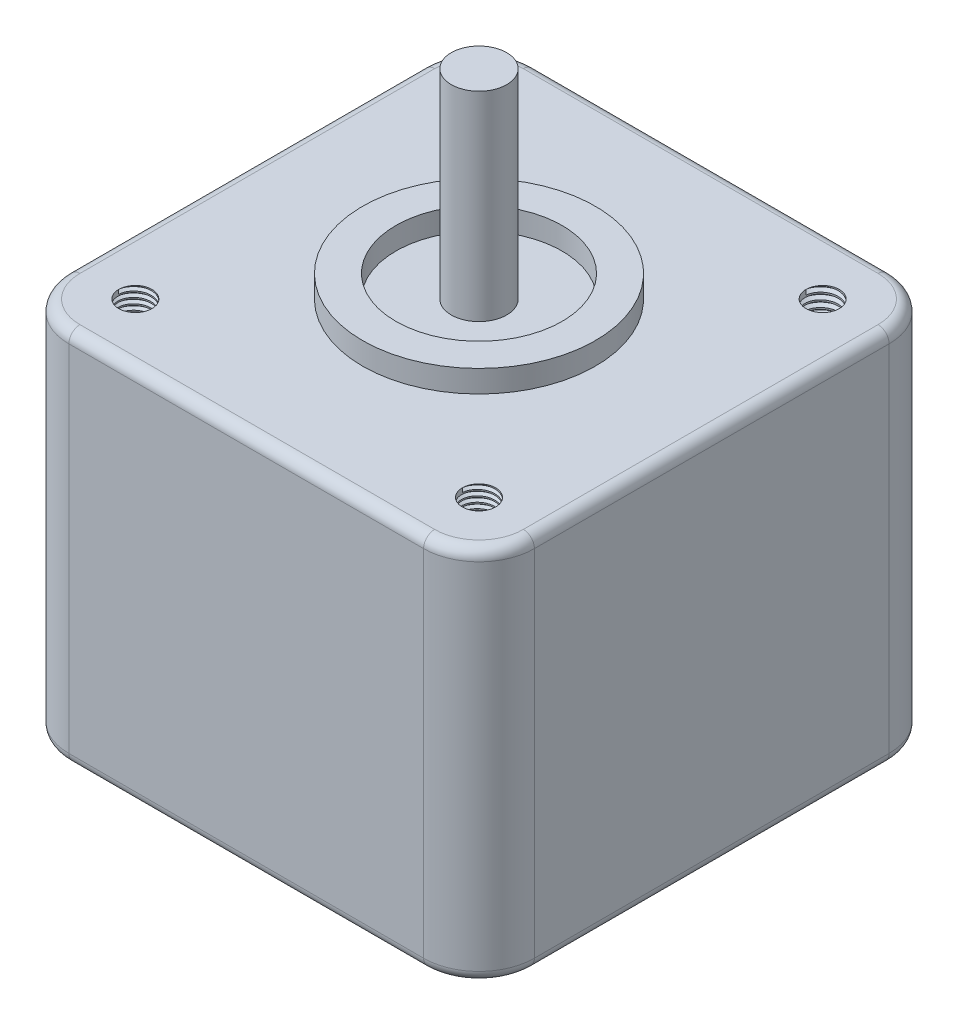
from build123d import *

# Parameters (mm, degrees)
BOSS_EXTRUDE1_DEPTH     = 34
SKETCH3_R               = 10.5
SKETCH3_R_2             = 7.5
BOSS_EXTRUDE2_DEPTH     = 2
SKETCH4_R               = 2.5
BOSS_EXTRUDE3_DEPTH     = 18
ADVANCEDHOLE1_START     = 29
ADVANCEDHOLE1_OUTLINE_R = 1.5
ADVANCEDHOLE1_DEPTH     = 5
THREAD1_PITCH           = 0.6
LPATTERN1_COUNT         = 2
LPATTERN1_PITCH         = 31
THREAD2_PITCH           = 0.5
THREAD3_PITCH           = 0.5
FILLET1_R               = 1


# Read off the part's stored shape, not the designer's step: AdvancedHole1
with BuildPart() as part:
    # Sketch2 → Boss-Extrude1 (new body)
    with BuildSketch(Plane(origin=(0, 0, 0), x_dir=(1, 0, 0), z_dir=(0, 1, 0))):
        with BuildLine():
            Line((-16, -21), (16, -21))
            ThreePointArc((16, -21), (19.535533906, -19.535533906), (21, -16))
            Line((21, -16), (21, 16))
            ThreePointArc((21, 16), (19.535533906, 19.535533906), (16, 21))
            Line((16, 21), (-16, 21))
            ThreePointArc((-16, 21), (-19.535533906, 19.535533906), (-21, 16))
            Line((-21, 16), (-21, -16))
            ThreePointArc((-21, -16), (-19.535533906, -19.535533906), (-16, -21))
        make_face()
    extrude(amount=BOSS_EXTRUDE1_DEPTH)

    # Sketch3 → Boss-Extrude2 (add)
    with BuildSketch(Plane(origin=(0, 34, 0), x_dir=(1, 0, 0), z_dir=(0, 1, 0))):
        with Locations(Location((0, 0, 0), (0, 0, 270))):
            Circle(SKETCH3_R)
        with Locations(Location((0, 0, 0), (0, 0, 270))):
            Circle(SKETCH3_R_2, mode=Mode.SUBTRACT)
    extrude(amount=BOSS_EXTRUDE2_DEPTH)

    # Sketch4 → Boss-Extrude3 (add)
    with BuildSketch(Plane(origin=(0, 34, 0), x_dir=(1, 0, 0), z_dir=(0, 1, 0))):
        with Locations(Location((0, 0, 0), (0, 0, 270))):
            Circle(SKETCH4_R)
    extrude(amount=BOSS_EXTRUDE3_DEPTH)

    # AdvancedHole1 outline → AdvancedHole1 (cut)
    with BuildSketch(Plane(origin=(0, 0, 0), x_dir=(1, 0, 0), z_dir=(0, 1, 0)).offset(ADVANCEDHOLE1_START)):
        with Locations((-15.5, -15.5)):
            Circle(ADVANCEDHOLE1_OUTLINE_R)
        with Locations((15.5, -15.5)):
            Circle(ADVANCEDHOLE1_OUTLINE_R)
        with Locations((15.5, 15.5)):
            Circle(ADVANCEDHOLE1_OUTLINE_R)
        with Locations((-15.5, 15.5)):
            Circle(ADVANCEDHOLE1_OUTLINE_R)
    extrude(amount=ADVANCEDHOLE1_DEPTH, mode=Mode.SUBTRACT)

    # Thread1: the profile of Thread Profile1 profile screwed along a right-hand helix of 8.333333 turns, 6 arcs to a turn; built about Z, then put on its axis
    thread1_z = Axis((0, 0, 0), (0, 0, 1))
    thread1_corners = [(1.4997, 0, -0.000173205), (1.824759525, 0, 0.187499999), (1.824759525, 0, 0.262499999), (1.4997, 0, 0.450173203)]
    with BuildLine(mode=Mode.PRIVATE) as thread1_profile:
        Line(thread1_corners[0], thread1_corners[1])
        Line(thread1_corners[1], thread1_corners[2])
        Line(thread1_corners[2], thread1_corners[3])
        Line(thread1_corners[3], thread1_corners[0])
    thread1_cap = Face(thread1_profile.wire())
    thread1_turn_angles = [0, 30, 60, 90, 120, 150, 180, 210, 240, 270, 300, 330, 360]
    thread1_turn_weights = [1, 0.8660254037844387, 1, 0.8660254037844387, 1, 0.8660254037844387, 1, 0.8660254037844387, 1, 0.8660254037844387, 1, 0.8660254037844387, 1]
    thread1_turn_rails = [Edge.make_bspline([Vector(p[0], p[1], 0).rotate(thread1_z, thread1_turn_angles[k]) / thread1_turn_weights[k] + Vector(0, 0, p[2] + THREAD1_PITCH * thread1_turn_angles[k] / 360) for k in range(13)], [0, 0, 0, 1, 1, 2, 2, 3, 3, 4, 4, 5, 5, 6, 6, 6], 2, thread1_turn_weights) for p in thread1_corners]
    thread1_turn_sides = [Face.make_surface_from_curves(thread1_turn_rails[p[0]], thread1_turn_rails[p[1]]) for p in [(0, 1), (1, 2), (2, 3), (3, 0)]]
    thread1_last_angles = [2880, 2910, 2940, 2970, 3000]
    thread1_last_weights = [1, 0.8660254037844387, 1, 0.8660254037844367, 1]
    thread1_last_rails = [Edge.make_bspline([Vector(p[0], p[1], 0).rotate(thread1_z, thread1_last_angles[k]) / thread1_last_weights[k] + Vector(0, 0, p[2] + THREAD1_PITCH * thread1_last_angles[k] / 360) for k in range(5)], [0, 0, 0, 1, 1, 2, 2, 2], 2, thread1_last_weights) for p in thread1_corners]
    thread1_last_sides = [Face.make_surface_from_curves(thread1_last_rails[p[0]], thread1_last_rails[p[1]]) for p in [(0, 1), (1, 2), (2, 3), (3, 0)]]
    thread1 = Plane(origin=(-15.5, 34, -15.5), x_dir=(-1, 0, 0), z_dir=(0, -1, 0)) * Solid(Shell([*[p.moved(Location((0, 0, THREAD1_PITCH * i))) for i in range(8) for p in thread1_turn_sides], *thread1_last_sides, thread1_cap, thread1_cap.rotate(thread1_z, 3000).moved(Location((0, 0, THREAD1_PITCH * 3000 / 360)))]))
    add(thread1, mode=Mode.SUBTRACT)

    # LPattern1: Thread1 ×2
    with Locations(*[(i * LPATTERN1_PITCH, 0, 0) for i in range(1, LPATTERN1_COUNT)]):
        add(thread1, mode=Mode.SUBTRACT)

    # Thread2: the profile of Thread Profile4 profile screwed along a right-hand helix of 10 turns, 6 arcs to a turn; built about Z, then put on its axis
    thread2_z = Axis((0, 0, 0), (0, 0, 1))
    thread2_corners = [(1.4997, 0, -0.000173205), (1.770632938, 0, 0.156249999), (1.770632938, 0, 0.218749999), (1.4997, 0, 0.375173204)]
    with BuildLine(mode=Mode.PRIVATE) as thread2_profile:
        Line(thread2_corners[0], thread2_corners[1])
        Line(thread2_corners[1], thread2_corners[2])
        Line(thread2_corners[2], thread2_corners[3])
        Line(thread2_corners[3], thread2_corners[0])
    thread2_cap = Face(thread2_profile.wire())
    thread2_turn_angles = [0, 30, 60, 90, 120, 150, 180, 210, 240, 270, 300, 330, 360]
    thread2_turn_weights = [1, 0.8660254037844387, 1, 0.8660254037844387, 1, 0.8660254037844387, 1, 0.8660254037844387, 1, 0.8660254037844387, 1, 0.8660254037844387, 1]
    thread2_turn_rails = [Edge.make_bspline([Vector(p[0], p[1], 0).rotate(thread2_z, thread2_turn_angles[k]) / thread2_turn_weights[k] + Vector(0, 0, p[2] + THREAD2_PITCH * thread2_turn_angles[k] / 360) for k in range(13)], [0, 0, 0, 1, 1, 2, 2, 3, 3, 4, 4, 5, 5, 6, 6, 6], 2, thread2_turn_weights) for p in thread2_corners]
    thread2_turn_sides = [Face.make_surface_from_curves(thread2_turn_rails[p[0]], thread2_turn_rails[p[1]]) for p in [(0, 1), (1, 2), (2, 3), (3, 0)]]
    thread2 = Plane(origin=(15.5, 34, 15.5), x_dir=(-1, 0, 0), z_dir=(0, -1, 0)) * Solid(Shell([*[p.moved(Location((0, 0, THREAD2_PITCH * i))) for i in range(10) for p in thread2_turn_sides], thread2_cap, thread2_cap.rotate(thread2_z, 3600).moved(Location((0, 0, THREAD2_PITCH * 3600 / 360)))]))
    add(thread2, mode=Mode.SUBTRACT)

    # Thread3: the profile of Thread Profile5 profile screwed along a right-hand helix of 10 turns, 6 arcs to a turn; built about Z, then put on its axis
    thread3_z = Axis((0, 0, 0), (0, 0, 1))
    thread3_corners = [(1.4997, 0, -0.000173205), (1.770632938, 0, 0.156249999), (1.770632938, 0, 0.218749999), (1.4997, 0, 0.375173204)]
    with BuildLine(mode=Mode.PRIVATE) as thread3_profile:
        Line(thread3_corners[0], thread3_corners[1])
        Line(thread3_corners[1], thread3_corners[2])
        Line(thread3_corners[2], thread3_corners[3])
        Line(thread3_corners[3], thread3_corners[0])
    thread3_cap = Face(thread3_profile.wire())
    thread3_turn_angles = [0, 30, 60, 90, 120, 150, 180, 210, 240, 270, 300, 330, 360]
    thread3_turn_weights = [1, 0.8660254037844387, 1, 0.8660254037844387, 1, 0.8660254037844387, 1, 0.8660254037844387, 1, 0.8660254037844387, 1, 0.8660254037844387, 1]
    thread3_turn_rails = [Edge.make_bspline([Vector(p[0], p[1], 0).rotate(thread3_z, thread3_turn_angles[k]) / thread3_turn_weights[k] + Vector(0, 0, p[2] + THREAD3_PITCH * thread3_turn_angles[k] / 360) for k in range(13)], [0, 0, 0, 1, 1, 2, 2, 3, 3, 4, 4, 5, 5, 6, 6, 6], 2, thread3_turn_weights) for p in thread3_corners]
    thread3_turn_sides = [Face.make_surface_from_curves(thread3_turn_rails[p[0]], thread3_turn_rails[p[1]]) for p in [(0, 1), (1, 2), (2, 3), (3, 0)]]
    thread3 = Plane(origin=(-15.5, 34, 15.5), x_dir=(-1, 0, 0), z_dir=(0, -1, 0)) * Solid(Shell([*[p.moved(Location((0, 0, THREAD3_PITCH * i))) for i in range(10) for p in thread3_turn_sides], thread3_cap, thread3_cap.rotate(thread3_z, 3600).moved(Location((0, 0, THREAD3_PITCH * 3600 / 360)))]))
    add(thread3, mode=Mode.SUBTRACT)

    # Fillet1
    fillet1_edges = [part.edges().sort_by_distance(p)[0] for p in [
        (0, 0, -21),
        (19.535533906, 0, -19.535533906),
        (21, 0, 0),
        (19.535533906, 0, 19.535533906),
        (19.535533906, 34, -19.535533906),
        (0, 34, -21),
        (-19.535533906, 34, -19.535533906),
        (-21, 34, 0),
        (-19.535533906, 34, 19.535533906),
        (0, 34, 21),
        (19.535533906, 34, 19.535533906),
        (0, 0, 21),
        (21, 34, 0),
        (-19.535533906, 0, 19.535533906),
        (-21, 0, 0),
        (-19.535533906, 0, -19.535533906),
    ]]
    fillet(fillet1_edges, radius=FILLET1_R)


solid = part.part
